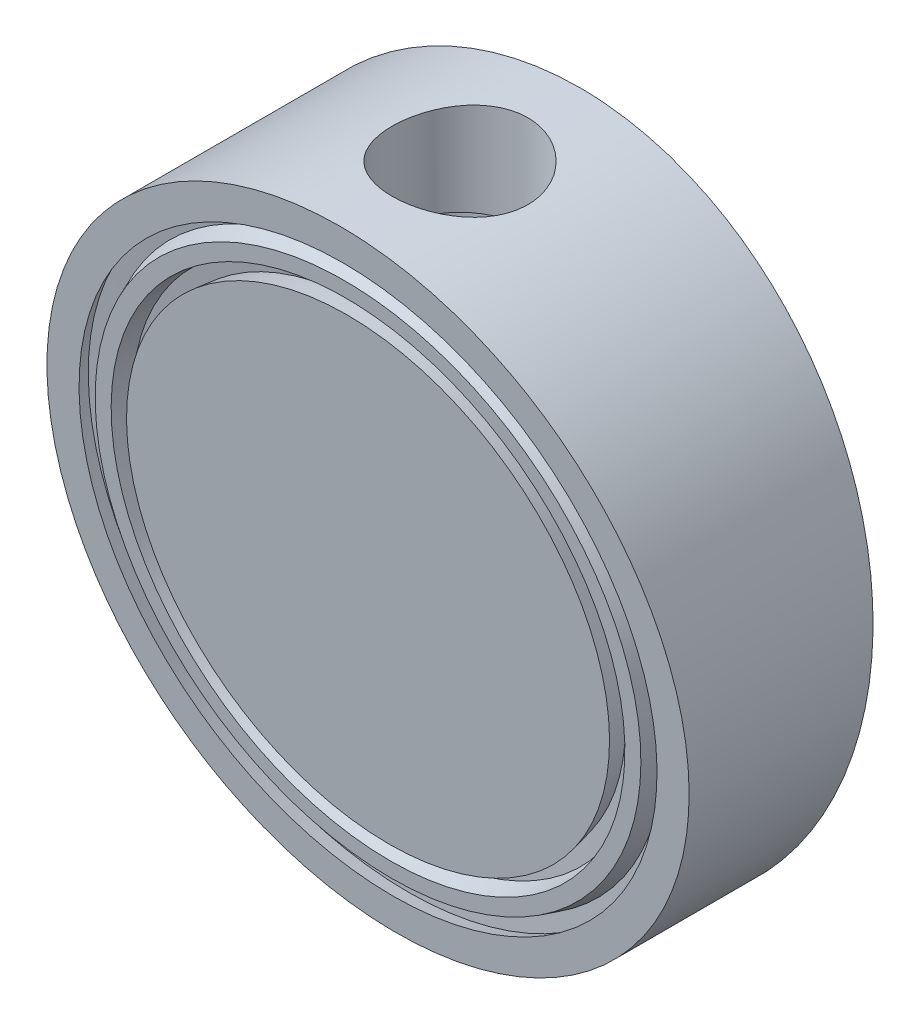
from build123d import *

# Parameters (mm, degrees)
SKETCH1_W                           = 47.625
SKETCH1_H                           = 63.5
CUT_EXTRUDE1_REACH                  = 94.906
CUT_EXTRUDE1_END_RADIUS             = 63.5
CUT_EXTRUDE1_DIRECTION_2_REACH      = 94.906
CUT_EXTRUDE1_DIRECTION_2_END_RADIUS = 63.5


with BuildPart() as part:
    # Sketch1 → Revolve1 (revolve)
    with BuildSketch(Plane(origin=(0, 0, 0), x_dir=(0, 0, -1), z_dir=(1, 0, 0))):
        with Locations((0, 31.75)):
            Rectangle(SKETCH1_W, SKETCH1_H)
    revolve(axis=Axis((0, 0, 23.8125), (0, 0, -1)))

    # Cut-Extrude1: up to this cylinder (the profile starts inside it)
    cut_extrude1_end = Plane(origin=(0, 0, 0), z_dir=(0, 0, 1)) * Cylinder(CUT_EXTRUDE1_END_RADIUS, 358.028666, mode=Mode.PRIVATE)
    # Sketch2 → Cut-Extrude1 (cut, up to the surface)
    with BuildSketch(Plane(origin=(0, 0, 0), x_dir=(0, 0, -1), z_dir=(1, 0, 0)), mode=Mode.PRIVATE) as cut_extrude1_sk1:
        Polygon((23.8125, 63.5), (12.7, -63.5), (23.8125, -63.5), align=None)
    cut_extrude1_tool1 = extrude(cut_extrude1_sk1.sketch, amount=-CUT_EXTRUDE1_REACH, mode=Mode.PRIVATE) & cut_extrude1_end
    add(cut_extrude1_tool1.solids().sort_by_distance((0, -21.166667, -20.108333))[0], mode=Mode.SUBTRACT)
    # Sketch2 → Cut-Extrude1 (cut, up to the surface)
    with BuildSketch(Plane(origin=(0, 0, 0), x_dir=(0, 0, -1), z_dir=(1, 0, 0)), mode=Mode.PRIVATE) as cut_extrude1_sk2:
        Polygon((-12.7, -63.5), (-23.8125, 63.5), (-23.8125, -63.5), align=None)
    cut_extrude1_tool2 = extrude(cut_extrude1_sk2.sketch, amount=-CUT_EXTRUDE1_REACH, mode=Mode.PRIVATE) & cut_extrude1_end
    add(cut_extrude1_tool2.solids().sort_by_distance((0, -21.166667, 20.108333))[0], mode=Mode.SUBTRACT)

    # Cut-Extrude1 direction 2: up to this cylinder (the profile starts inside it)
    cut_extrude1_direction_2_end = Plane(origin=(0, 0, 0), z_dir=(0, 0, 1)) * Cylinder(CUT_EXTRUDE1_DIRECTION_2_END_RADIUS, 358.028666, mode=Mode.PRIVATE)
    # Sketch2 → Cut-Extrude1 direction 2 (cut, up to the surface)
    with BuildSketch(Plane(origin=(0, 0, 0), x_dir=(0, 0, -1), z_dir=(1, 0, 0)), mode=Mode.PRIVATE) as cut_extrude1_direction_2_sk1:
        Polygon((23.8125, 63.5), (12.7, -63.5), (23.8125, -63.5), align=None)
    cut_extrude1_direction_2_tool1 = extrude(cut_extrude1_direction_2_sk1.sketch, amount=CUT_EXTRUDE1_DIRECTION_2_REACH, mode=Mode.PRIVATE) & cut_extrude1_direction_2_end
    add(cut_extrude1_direction_2_tool1.solids().sort_by_distance((0, -21.166667, -20.108333))[0], mode=Mode.SUBTRACT)
    # Sketch2 → Cut-Extrude1 direction 2 (cut, up to the surface)
    with BuildSketch(Plane(origin=(0, 0, 0), x_dir=(0, 0, -1), z_dir=(1, 0, 0)), mode=Mode.PRIVATE) as cut_extrude1_direction_2_sk2:
        Polygon((-12.7, -63.5), (-23.8125, 63.5), (-23.8125, -63.5), align=None)
    cut_extrude1_direction_2_tool2 = extrude(cut_extrude1_direction_2_sk2.sketch, amount=CUT_EXTRUDE1_DIRECTION_2_REACH, mode=Mode.PRIVATE) & cut_extrude1_direction_2_end
    add(cut_extrude1_direction_2_tool2.solids().sort_by_distance((0, -21.166667, 20.108333))[0], mode=Mode.SUBTRACT)

    # Sketch3 → Cut-Revolve1 (revolve, cut)
    with BuildSketch(Plane(origin=(0, 0, 0), x_dir=(0, 0, -1), z_dir=(1, 0, 0))):
        Polygon((-13.552471291, -53.757470955), (-13.274658791, -56.932470955), (-10.288822106, -57.732523484), (-10.288822106, -54.631963119), align=None)
        Polygon((-14.093252917, -47.577109525), (-13.828168926, -50.606640849), (-10.288822106, -49.658275727), (-10.288822106, -46.557715362), align=None)
    revolve(axis=Axis((0, 0, 18.25625), (0, 0.08716695028091019, -0.9961937174961131)), mode=Mode.SUBTRACT)

    # Sketch3<4> → Cut-Revolve2 (revolve, cut)
    with BuildSketch(Plane(origin=(0, 0, 0), x_dir=(0, 0, -1), z_dir=(1, 0, 0))):
        Polygon((13.274658791, -56.932470955), (13.552471291, -53.757470955), (10.288822106, -54.631963119), (10.288822106, -57.732523484), align=None)
        Polygon((14.093252917, -47.577109525), (10.288822106, -46.557715362), (10.288822106, -49.658275727), (13.828168926, -50.606640849), align=None)
    revolve(axis=Axis((0, 0, -18.25625), (0, 0.08716695028091019, 0.9961937174961131)), mode=Mode.SUBTRACT)

    # Sketch4 → Cut-Revolve3 (revolve, cut)
    with BuildSketch(Plane(origin=(0, 0, 0), x_dir=(0, 0, -1), z_dir=(1, 0, 0))):
        with BuildLine():
            Line((0, -63.5), (0, 63.5))
            Line((0, 63.5), (0, 76.2))
            Line((0, 76.2), (-13.49375, 76.2))
            Line((-13.49375, 76.2), (-13.49375, 44.45))
            Line((-13.49375, 44.45), (-14.385385309, 44.45))
            ThreePointArc((-14.385385309, 44.45), (-15.321732353, 44.037994297), (-15.65055133, 43.069297973))
            Line((-15.65055133, 43.069297973), (-7.9375, -45.079860082))
            Line((-7.9375, -45.079860082), (-6.35, -46.667360082))
            Line((-6.35, -46.667360082), (-6.35, -60.325))
            Line((-6.35, -60.325), (-9.525, -63.5))
            Line((-9.525, -63.5), (0, -63.5))
        make_face()
    revolve(axis=Axis((0, 63.5, 0), (0, -1, 0)), mode=Mode.SUBTRACT)


solid = part.part
